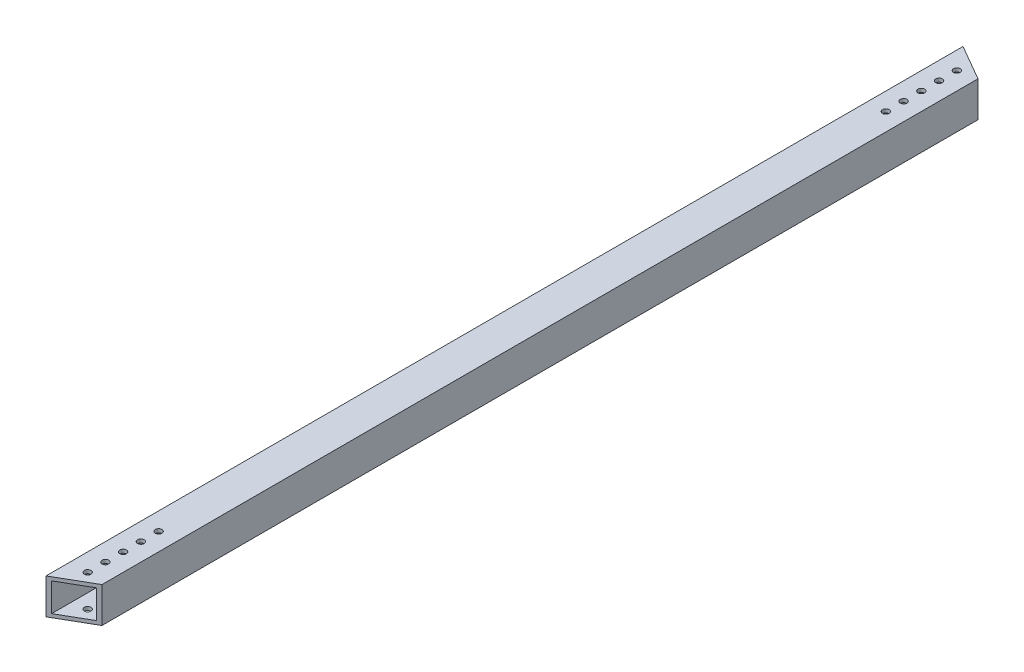
from build123d import *

# Parameters (mm, degrees)
SKETCH1_W           = 25.4
SKETCH1_H           = 25.4
SKETCH1_W_2         = 20.32
SKETCH1_H_2         = 20.32
BOSS_EXTRUDE2_DEPTH = 656.5743028
CUT_EXTRUDE1_DEPTH  = 658.188150454
SKETCH3_R           = 2.38125
CUT_EXTRUDE2_DEPTH  = 658.188150454


with BuildPart() as part:
    # Sketch1 → Boss-Extrude2 (new body)
    with BuildSketch(Plane.XY):
        Rectangle(SKETCH1_W, SKETCH1_H)
        Rectangle(SKETCH1_W_2, SKETCH1_H_2, mode=Mode.SUBTRACT)
    extrude(amount=BOSS_EXTRUDE2_DEPTH)

    # Sketch2 → Cut-Extrude1 (cut, through all)
    with BuildSketch(Plane(origin=(0, 12.7, 0), x_dir=(1, 0, 0), z_dir=(0, 1, 0))):
        Polygon((-12.7, -656.5743028), (12.7, -641.909605963), (12.7, -656.5743028), align=None)
        Polygon((12.7, 0), (-12.7, 0), (12.7, -14.664696837), align=None)
    extrude(amount=-CUT_EXTRUDE1_DEPTH, mode=Mode.SUBTRACT)

    # Sketch3 → Cut-Extrude2 (cut, through all)
    with BuildSketch(Plane(origin=(0, 12.7, 0), x_dir=(1, 0, 0), z_dir=(0, 1, 0))):
        with Locations((0, -639.4371514)):
            Circle(SKETCH3_R)
        with Locations((0, -626.7371514)):
            Circle(SKETCH3_R)
        with Locations((0, -614.0371514)):
            Circle(SKETCH3_R)
        with Locations((0, -601.3371514)):
            Circle(SKETCH3_R)
        with Locations((0, -588.6371514)):
            Circle(SKETCH3_R)
        with Locations((0, -67.9371514)):
            Circle(SKETCH3_R)
        with Locations((0, -55.2371514)):
            Circle(SKETCH3_R)
        with Locations((0, -42.5371514)):
            Circle(SKETCH3_R)
        with Locations((0, -29.8371514)):
            Circle(SKETCH3_R)
        with Locations((0, -17.1371514)):
            Circle(SKETCH3_R)
    extrude(amount=-CUT_EXTRUDE2_DEPTH, mode=Mode.SUBTRACT)


solid = part.part
